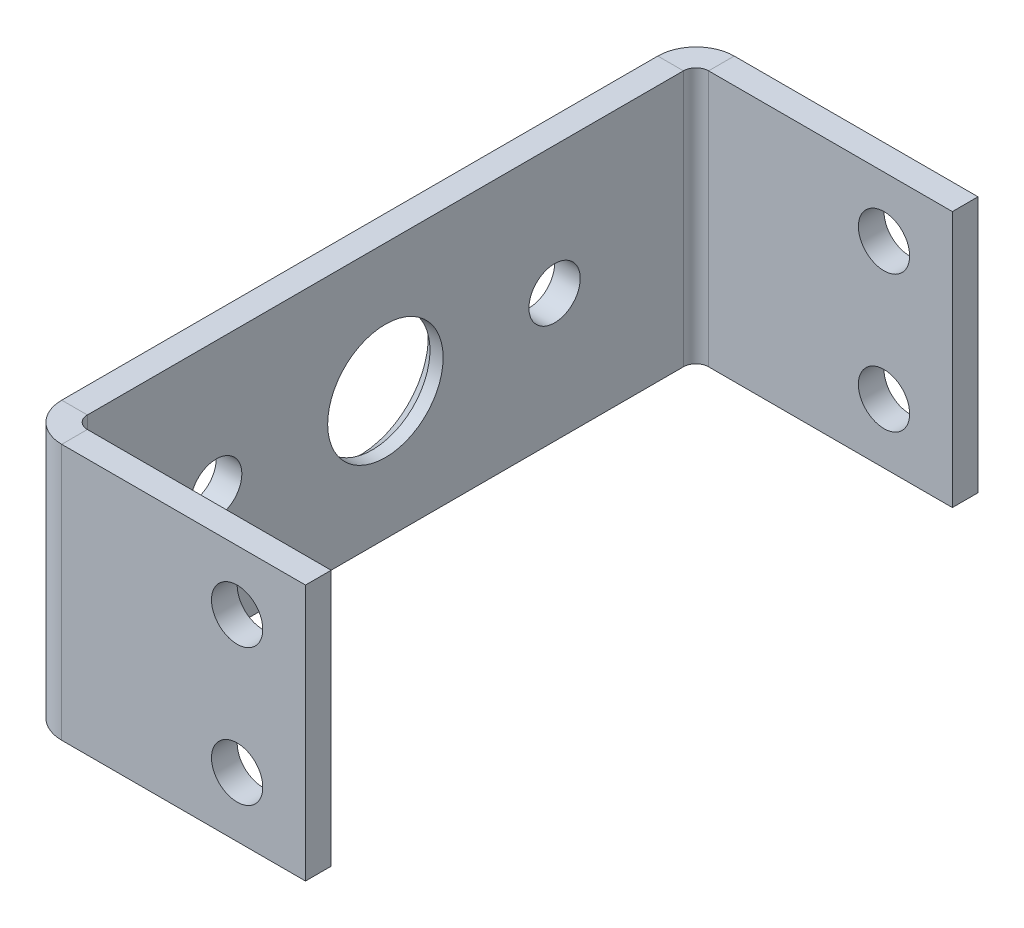
from build123d import *

# Parameters (mm, degrees)
BRIDA_BASE2_DEPTH                       = 7.5
CROQUIS10_R                             = 1.5
CORTAR_EXTRUIR1_DEPTH                   = 43.774671244
CORTAR_EXTRUIR2_REACH                   = 27.853
CROQUIS13_R                             = 1.5
TALADRO_DE_MARGEN_PARA_1_41_D           = 6.7564
TALADRO_DE_MARGEN_PARA_1_41_DEPTH       = 3.65
TALADRO_DE_MARGEN_PARA_1_41_CSINK_D     = 8.0264
TALADRO_DE_MARGEN_PARA_1_41_CSINK_ANGLE = 82
TALADRO_DE_MARGEN_PARA_1_41_TIP         = 2.029827343


# Sheet-metal steps are written as plain solids
with BuildPart() as part:
    # Croquis1 → Brida base2 (new, symmetric)
    with BuildSketch(Plane(origin=(122.052362923, 0, 0), x_dir=(1, 0, 0), z_dir=(0, 1, 0))):
        with BuildLine():
            Line((-107.052362923, 18.175), (-121.315762923, 18.175))
            ThreePointArc((-121.315762923, 18.175), (-121.836617778, 17.959254855), (-122.052362923, 17.4384))
            Line((-122.052362923, 17.4384), (-122.052362923, -17.4384))
            ThreePointArc((-122.052362923, -17.4384), (-121.836617778, -17.959254855), (-121.315762923, -18.175))
            Line((-121.315762923, -18.175), (-107.052362923, -18.175))
            Line((-107.052362923, -18.175), (-107.052362923, -19.675))
            Line((-107.052362923, -19.675), (-121.315762923, -19.675))
            ThreePointArc((-121.315762923, -19.675), (-122.89727795, -19.019915027), (-123.552362923, -17.4384))
            Line((-123.552362923, -17.4384), (-123.552362923, 17.4384))
            ThreePointArc((-123.552362923, 17.4384), (-122.89727795, 19.019915027), (-121.315762923, 19.675))
            Line((-121.315762923, 19.675), (-107.052362923, 19.675))
            Line((-107.052362923, 19.675), (-107.052362923, 18.175))
        make_face()
    extrude(amount=BRIDA_BASE2_DEPTH, both=True)

    # Croquis10 → Cortar-Extruir1 (cut, through all)
    with BuildSketch(Plane(origin=(0, 0, -19.675), x_dir=(-1, 0, 0), z_dir=(0, 0, -1))):
        with Locations((-11, 4)):
            Circle(CROQUIS10_R)
        with Locations((-11, -4)):
            Circle(CROQUIS10_R)
    extrude(amount=-CORTAR_EXTRUIR1_DEPTH, mode=Mode.SUBTRACT)

    # Croquis13 → Cortar-Extruir2 (cut, up to next)
    with BuildSketch(Plane(origin=(0, 0, 0), x_dir=(0, 0, 1), z_dir=(1, 0, 0)), mode=Mode.PRIVATE) as cortar_extruir2_sk1:
        with Locations(Location((-9.9, 0, 0), (0, 0, 270))):
            Circle(CROQUIS13_R)
    cortar_extruir2_tool1 = extrude(cortar_extruir2_sk1.sketch, amount=-CORTAR_EXTRUIR2_REACH, mode=Mode.PRIVATE) & part.part
    # Croquis13 → Cortar-Extruir2 (cut, up to next)
    with BuildSketch(Plane(origin=(0, 0, 0), x_dir=(0, 0, 1), z_dir=(1, 0, 0)), mode=Mode.PRIVATE) as cortar_extruir2_sk2:
        with Locations(Location((9.9, 0, 0), (0, 0, 270))):
            Circle(CROQUIS13_R)
    cortar_extruir2_tool2 = extrude(cortar_extruir2_sk2.sketch, amount=-CORTAR_EXTRUIR2_REACH, mode=Mode.PRIVATE) & part.part
    add(cortar_extruir2_tool1.solids().sort_by_distance((0, 0, -9.9))[0], mode=Mode.SUBTRACT)
    add(cortar_extruir2_tool2.solids().sort_by_distance((0, 0, 9.9))[0], mode=Mode.SUBTRACT)

    # Taladro de margen para 1/41
    with Locations(Plane.ZY.offset(1.5)):
        with Locations((0, 0)):
            CounterSinkHole(TALADRO_DE_MARGEN_PARA_1_41_D / 2, TALADRO_DE_MARGEN_PARA_1_41_CSINK_D / 2, depth=TALADRO_DE_MARGEN_PARA_1_41_DEPTH, counter_sink_angle=TALADRO_DE_MARGEN_PARA_1_41_CSINK_ANGLE)
            with Locations((0, 0, -(TALADRO_DE_MARGEN_PARA_1_41_DEPTH + TALADRO_DE_MARGEN_PARA_1_41_TIP / 2))):  # 118° drill point
                Cone(0, TALADRO_DE_MARGEN_PARA_1_41_D / 2, TALADRO_DE_MARGEN_PARA_1_41_TIP, mode=Mode.SUBTRACT)


solid = part.part
